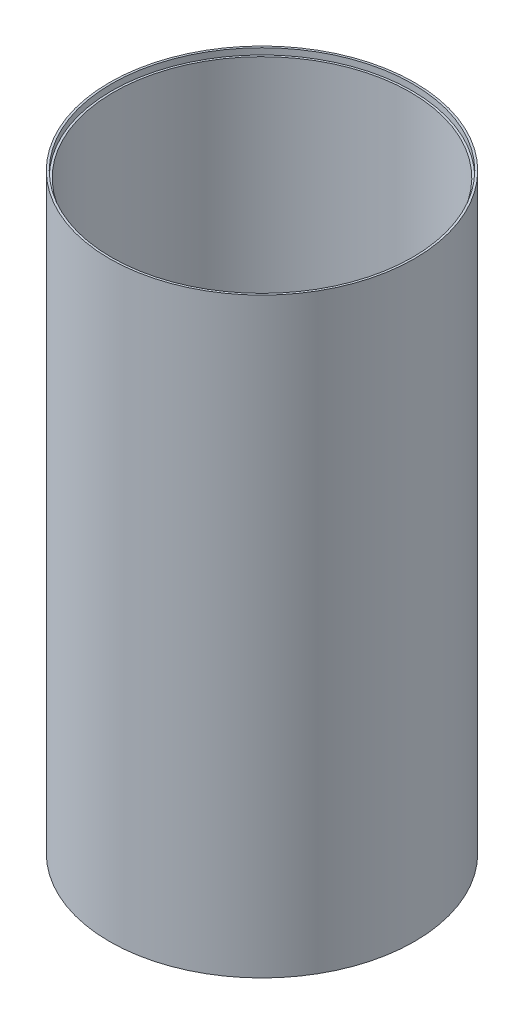
from build123d import *


with BuildPart() as part:
    # Schizzo1 → Rivoluzione1 (revolve)
    with BuildSketch(Plane.XY):
        Polygon((-72, 0), (-72, 3), (-71, 3), (-71, 280), (-72, 280), (-72, 283), (-73, 283), (-73, 0), align=None)
    revolve(axis=Axis((0, 0, 0), (0, 1, 0)))


solid = part.part
